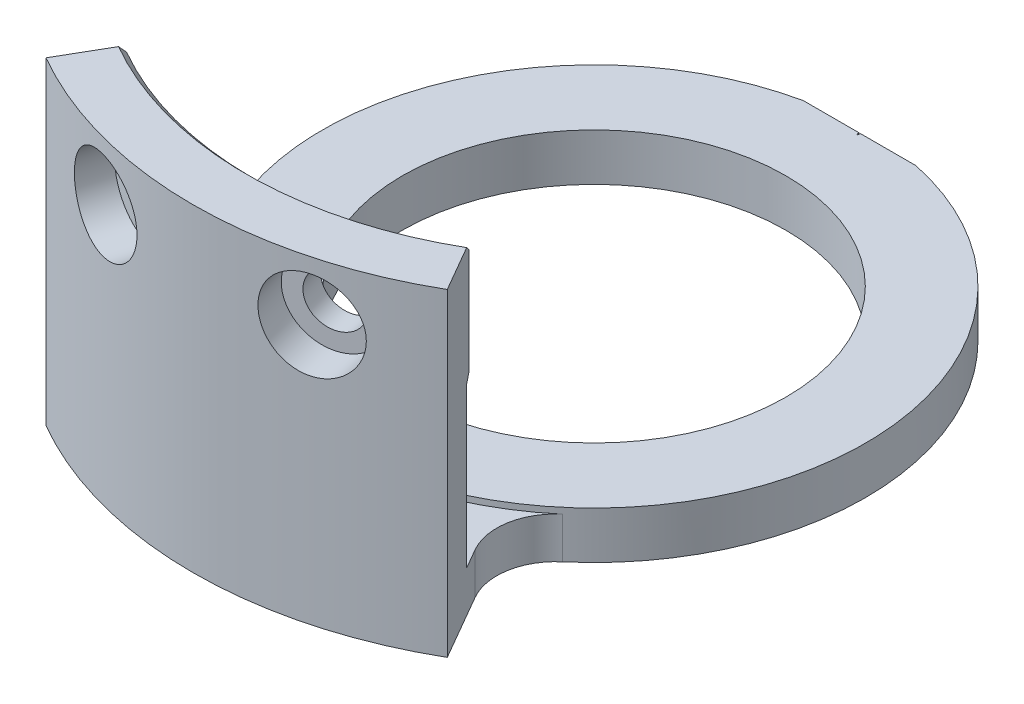
from build123d import *

# Parameters (mm, degrees)
SKETCH_1_R                          = 23
EXTRUDE_1_DEPTH                     = 4
CUT_EXTRUDE_1_DEPTH                 = 33.771939216
CUT_EXTRUDE_1_DEPTH_BACK            = 33.771939216
SKETCH_4_R                          = 16.25
CUT_EXTRUDE_2_DEPTH                 = 33.771939216
EXTRUDE_2_DEPTH                     = 3.5
FILLET_1_R                          = 5
EXTRUDE_START                       = -3.5
EXTRUDE_3_DEPTH                     = 27
CUT_EXTRUDE_START                   = -10
CUT_EXTRUDE_1_2_DEPTH               = 13.5
CHAMFER_1_SIZE                      = 0.5
HOLE_WIZARD_2_D                     = 4.5
HOLE_WIZARD_2_DEPTH                 = 7.5
HOLE_WIZARD_2_CBORE_D               = 7.5
HOLE_WIZARD_2_CBORE_DEPTH           = 3
HOLE_WIZARD_2_ON_FACE_2_D           = 4.5
HOLE_WIZARD_2_ON_FACE_2_DEPTH       = 7.5
HOLE_WIZARD_2_ON_FACE_2_CBORE_D     = 7.5
HOLE_WIZARD_2_ON_FACE_2_CBORE_DEPTH = 3
SKETCH_12_W                         = 0.1
SKETCH_12_H                         = 3
CUT_EXTRUDE_2_2_DEPTH               = 0.2


with BuildPart() as part:
    # 草图1 → 凸台-拉伸1 (new body)
    with BuildSketch(Plane(origin=(0, 0, 0), x_dir=(1, 0, 0), z_dir=(0, 1, 0))):
        with Locations(Location((0, 0, 0), (0, 0, 270))):
            Circle(SKETCH_1_R)
    extrude(amount=EXTRUDE_1_DEPTH)

    # 草图3 → Cut-Extrude 1 (cut, two sides: drawn at the far end of the back side and taken through both)
    with BuildSketch(Plane(origin=(0, 4, 0), x_dir=(1, 0, 0), z_dir=(0, 1, 0)).offset(-CUT_EXTRUDE_1_DEPTH_BACK)):
        Polygon((-121.379376924, 22.5), (-4.769696007, 22.5), (4.769696007, 22.5), (121.379376924, 22.5), (121.379376924, 255.719361835), (-121.379376924, 255.719361835), align=None)
    extrude(amount=CUT_EXTRUDE_1_DEPTH + CUT_EXTRUDE_1_DEPTH_BACK, mode=Mode.SUBTRACT)

    # 草图4 → Cut-Extrude 2 (cut, through all)
    with BuildSketch(Plane(origin=(0, 4, 0), x_dir=(1, 0, 0), z_dir=(0, 1, 0))):
        with Locations(Location((0, 0, 0), (0, 0, 270))):
            Circle(SKETCH_4_R)
    extrude(amount=-CUT_EXTRUDE_2_DEPTH, mode=Mode.SUBTRACT)

    # 草图5 → 凸台-拉伸2 (add)
    with BuildSketch(Plane(origin=(0, 0, 0), x_dir=(1, 0, 0), z_dir=(0, 1, 0))):
        with BuildLine():
            ThreePointArc((11.5, -19.918584287), (0, -23), (-11.5, -19.918584287))
            Line((-11.5, -19.918584287), (-17, -29.444863729))
            ThreePointArc((-17, -29.444863729), (0, -34), (17, -29.444863729))
            Line((17, -29.444863729), (11.5, -19.918584287))
        make_face()
    extrude(amount=EXTRUDE_2_DEPTH)

    # 圆角1
    fillet_1_edges = [part.edges().sort_by_distance(p)[0] for p in [
        (11.5, 1.75, 19.918584287),
        (-11.5, 1.75, 19.918584287),
    ]]
    fillet(fillet_1_edges, radius=FILLET_1_R)

    # 草图7 → 凸台-拉伸3 (add)
    with BuildSketch(Plane(origin=(0, 3.5, 0), x_dir=(1, 0, 0), z_dir=(0, 1, 0)).offset(EXTRUDE_START)):
        with BuildLine():
            Line((-14.5, -25.11473671), (-17, -29.444863729))
            ThreePointArc((-17, -29.444863729), (0, -34), (17, -29.444863729))
            Line((17, -29.444863729), (14.5, -25.11473671))
            ThreePointArc((14.5, -25.11473671), (0, -29), (-14.5, -25.11473671))
        make_face()
    extrude(amount=EXTRUDE_3_DEPTH)

    # 草图8 → Cut-Extrude 1 2 (cut)
    with BuildSketch(Plane(origin=(0, 27, 0), x_dir=(1, 0, 0), z_dir=(0, 1, 0)).offset(CUT_EXTRUDE_START)):
        with BuildLine():
            ThreePointArc((-14.75, -25.547749412), (0, -29.5), (14.75, -25.547749412))
            Line((14.75, -25.547749412), (14.25, -24.681724008))
            ThreePointArc((14.25, -24.681724008), (0, -28.5), (-14.25, -24.681724008))
            Line((-14.25, -24.681724008), (-14.75, -25.547749412))
        make_face()
    extrude(amount=-CUT_EXTRUDE_1_2_DEPTH, mode=Mode.SUBTRACT)

    # 倒角1
    chamfer_1_edges = [part.edges().sort_by_distance(p)[0] for p in [
        (0, 17, 29),
        (0, 27, 29),
    ]]
    chamfer(chamfer_1_edges, length=CHAMFER_1_SIZE - 0.0001)  # a hair under: the kernel refuses the full size

    # 孔2
    with Locations(Plane(origin=(8.799847533, 22, 32.841478094), x_dir=(0.965925826289, 0, -0.258819045103), z_dir=(0.258819045103, 0, 0.965925826289))):
        with Locations((1e-09, 0)):
            CounterBoreHole(HOLE_WIZARD_2_D / 2, HOLE_WIZARD_2_CBORE_D / 2, HOLE_WIZARD_2_CBORE_DEPTH, depth=HOLE_WIZARD_2_DEPTH)

    # 孔2 on face 2
    with Locations(Plane(origin=(-8.799847533, 22, 32.841478094), x_dir=(0.965925849201, 0, 0.258818959594), z_dir=(-0.258818959594, 0, 0.965925849201))):
        with Locations((-1e-09, 0)):
            CounterBoreHole(HOLE_WIZARD_2_ON_FACE_2_D / 2, HOLE_WIZARD_2_ON_FACE_2_CBORE_D / 2, HOLE_WIZARD_2_ON_FACE_2_CBORE_DEPTH, depth=HOLE_WIZARD_2_ON_FACE_2_DEPTH)

    # 草图12 → Cut-Extrude 2 2 (cut)
    with BuildSketch(Plane(origin=(0, 0, -22.5), x_dir=(-1, 0, 0), z_dir=(0, 0, -1))):
        with Locations((0, 2.5)):
            Rectangle(SKETCH_12_W, SKETCH_12_H)
    extrude(amount=-CUT_EXTRUDE_2_2_DEPTH, mode=Mode.SUBTRACT)


solid = part.part
